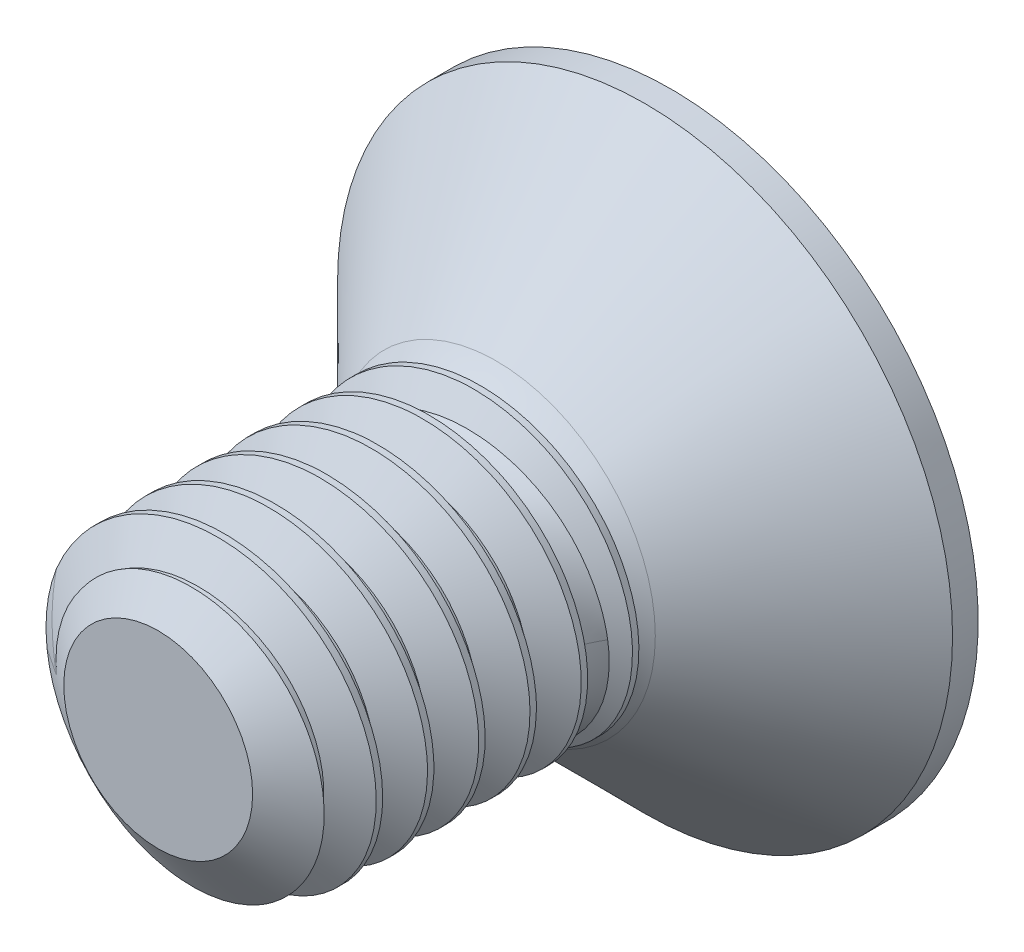
from build123d import *

# Parameters (mm, degrees)
SKETCH1_R          = 1.5
EXTRUDE1_DEPTH     = 5
CUT_SWEEP1_PITCH   = 0.5
SKETCH6_R          = 3
EXTRUDE2_DEPTH     = 1.7
CUT_EXTRUDE1_DEPTH = 1.5
SKETCH8_R          = 1.154700538
CUT_EXTRUDE2_DEPTH = 7.557438601
CUT_EXTRUDE2_TAPER = 45


with BuildPart() as part:
    # Sketch1 → Extrude1 (new body)
    with BuildSketch(Plane.XY):
        Circle(SKETCH1_R)
    extrude(amount=-EXTRUDE1_DEPTH)

    # Cut-Sweep1: the profile of Sketch3 profile screwed along a right-hand helix of 11 turns, 6 arcs to a turn; built about Z, then put on its axis
    cut_sweep1_z = Axis((0, 0, 0), (0, 0, 1))
    cut_sweep1_corners = [(1.5003, 0, -0.437673205), (1.175240474, 0, -0.25), (1.175240474, 0, -0.1875), (1.5003, 0, 0.000173205)]
    with BuildLine(mode=Mode.PRIVATE) as cut_sweep1_profile:
        Line(cut_sweep1_corners[0], cut_sweep1_corners[1])
        Line(cut_sweep1_corners[1], cut_sweep1_corners[2])
        Line(cut_sweep1_corners[2], cut_sweep1_corners[3])
        Line(cut_sweep1_corners[3], cut_sweep1_corners[0])
    cut_sweep1_cap = Face(cut_sweep1_profile.wire())
    cut_sweep1_turn_angles = [0, 30, 60, 90, 120, 150, 180, 210, 240, 270, 300, 330, 360]
    cut_sweep1_turn_weights = [1, 0.8660254037844387, 1, 0.8660254037844387, 1, 0.8660254037844387, 1, 0.8660254037844387, 1, 0.8660254037844387, 1, 0.8660254037844387, 1]
    cut_sweep1_turn_rails = [Edge.make_bspline([Vector(p[0], p[1], 0).rotate(cut_sweep1_z, cut_sweep1_turn_angles[k]) / cut_sweep1_turn_weights[k] + Vector(0, 0, p[2] + CUT_SWEEP1_PITCH * cut_sweep1_turn_angles[k] / 360) for k in range(13)], [0, 0, 0, 1, 1, 2, 2, 3, 3, 4, 4, 5, 5, 6, 6, 6], 2, cut_sweep1_turn_weights) for p in cut_sweep1_corners]
    cut_sweep1_turn_sides = [Face.make_surface_from_curves(cut_sweep1_turn_rails[p[0]], cut_sweep1_turn_rails[p[1]]) for p in [(0, 1), (1, 2), (2, 3), (3, 0)]]
    cut_sweep1 = Plane(origin=(0, 0, 0), x_dir=(0, 1, 0), z_dir=(0, 0, -1)) * Solid(Shell([*[p.moved(Location((0, 0, CUT_SWEEP1_PITCH * i))) for i in range(11) for p in cut_sweep1_turn_sides], cut_sweep1_cap, cut_sweep1_cap.rotate(cut_sweep1_z, 3960).moved(Location((0, 0, CUT_SWEEP1_PITCH * 3960 / 360)))]))
    add(cut_sweep1, mode=Mode.SUBTRACT)

    # Sketch4 → Cut-Revolve1 (revolve, cut)
    with BuildSketch(Plane(origin=(0, 0, 0), x_dir=(0, 0, -1), z_dir=(1, 0, 0)), mode=Mode.PRIVATE) as cut_revolve1_sk:
        Polygon((0.405251783, 1.5), (0, 0.921240474), (0, 1.5), align=None)
    revolve(cut_revolve1_sk.sketch.rotate(Axis((0, 0, 0), (0, 0, -1)), 263.352109169), axis=Axis((0, 0, 0), (0, 0, -1)), mode=Mode.SUBTRACT)

    # Sketch6 → Extrude2 (add)
    with BuildSketch(Plane(origin=(0, 0, -5), x_dir=(-1, 0, 0), z_dir=(0, 0, -1))):
        Circle(SKETCH6_R)
    extrude(amount=-EXTRUDE2_DEPTH)

    # Sketch10 → Cut-Revolve2 (revolve, cut)
    with BuildSketch(Plane(origin=(0, 0, 0), x_dir=(0, 0, -1), z_dir=(1, 0, 0)), mode=Mode.PRIVATE) as cut_revolve2_sk:
        Polygon((4.75, -3), (3.3, -1.55), (3.3, -3), align=None)
    revolve(cut_revolve2_sk.sketch.rotate(Axis((0, 0, 0), (0, 0, -1)), 270), axis=Axis((0, 0, 0), (0, 0, -1)), mode=Mode.SUBTRACT)

    # Sketch11 → Revolve1 (revolve)
    with BuildSketch(Plane(origin=(0, 0, 0), x_dir=(0, 0, -1), z_dir=(1, 0, 0)), mode=Mode.PRIVATE) as revolve1_sk:
        with BuildLine():
            Line((2.395250469, 1.175240474), (2.395250469, 0))
            Line((2.395250469, 0), (3.3, 0))
            Line((3.3, 0), (3.3, 1.55))
            ThreePointArc((3.3, 1.55), (2.884897387, 1.272637301), (2.395250469, 1.175240474))
        make_face()
    revolve(revolve1_sk.sketch.rotate(Axis((0, 0, 0), (0, 0, -1)), 90), axis=Axis((0, 0, 0), (0, 0, -1)))

    # Sketch7 → Cut-Extrude1 (cut)
    with BuildSketch(Plane.XY.offset(-5)):
        Polygon((0, 1.154700538), (-1, 0.577350269), (-1, -0.577350269), (0, -1.154700538), (1, -0.577350269), (1, 0.577350269), align=None)
    extrude(amount=CUT_EXTRUDE1_DEPTH, mode=Mode.SUBTRACT)

    # Sketch8 → Cut-Extrude2 (cut, through all)
    with BuildSketch(Plane.XY.offset(-5)):
        Circle(SKETCH8_R)
    extrude(amount=CUT_EXTRUDE2_DEPTH, taper=CUT_EXTRUDE2_TAPER, mode=Mode.SUBTRACT)


solid = part.part
